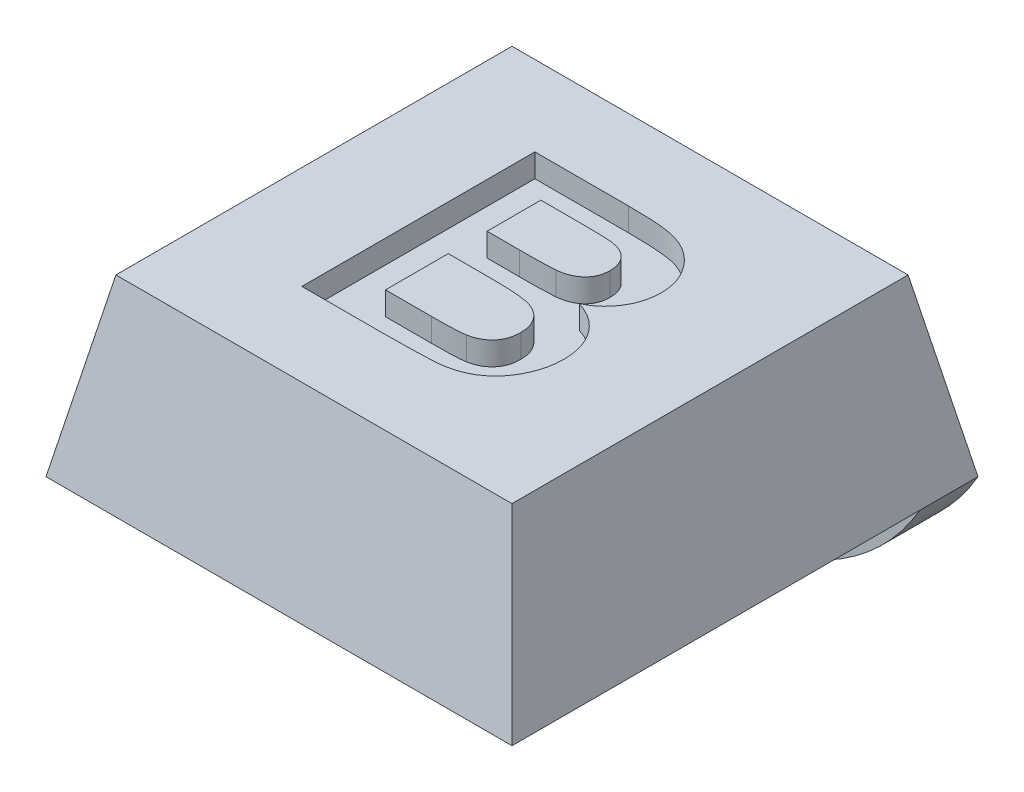
from build123d import *

# Parameters (mm, degrees)
SKETCH1_W               = 8
SKETCH1_H               = 8
BOSS_EXTRUDE1_DEPTH     = 3
CUT_EXTRUDE1_DEPTH      = 12.704699911
CUT_EXTRUDE1_DEPTH_BACK = 12.704699911
CUT_EXTRUDE2_DEPTH      = 11
SKETCH4_R               = 1.75
CUT_EXTRUDE3_DEPTH      = 0.4
SKETCH5_W               = 8
SKETCH5_H               = 1
BOSS_EXTRUDE2_DEPTH     = 2
FILLET1_R               = 4
CUT_EXTRUDE4_DEPTH      = 0.4


with BuildPart() as part:
    # Sketch1 → Boss-Extrude1 (new body)
    with BuildSketch(Plane(origin=(0, 0, 0), x_dir=(1, 0, 0), z_dir=(0, 1, 0))):
        with Locations((4, 4)):
            Rectangle(SKETCH1_W, SKETCH1_H)
    extrude(amount=BOSS_EXTRUDE1_DEPTH)

    # Sketch2 → Cut-Extrude1 (cut, two sides: drawn at the far end of the back side and taken through both)
    with BuildSketch(Plane.XY.offset(-CUT_EXTRUDE1_DEPTH_BACK)):
        Polygon((0, 0), (0.6, 3), (0, 3), align=None)
        Polygon((8, 0), (7.4, 3), (8, 3), align=None)
    extrude(amount=CUT_EXTRUDE1_DEPTH + CUT_EXTRUDE1_DEPTH_BACK, mode=Mode.SUBTRACT)

    # Sketch3 → Cut-Extrude2 (cut)
    with BuildSketch(Plane(origin=(0, 0, 0), x_dir=(0, 0, -1), z_dir=(1, 0, 0))):
        Polygon((0, 0), (0.6, 3), (0, 3), align=None)
        Polygon((8, 3), (7.4, 3), (8, 0), align=None)
    extrude(amount=CUT_EXTRUDE2_DEPTH, mode=Mode.SUBTRACT)

    # Sketch4 → Cut-Extrude3 (cut)
    with BuildSketch(Plane.XZ):
        with Locations(Location((4, -3.75, 0), (0, 0, 270))):
            Circle(SKETCH4_R)
    extrude(amount=-CUT_EXTRUDE3_DEPTH, mode=Mode.SUBTRACT)

    # Sketch5 → Boss-Extrude2 (add)
    with BuildSketch(Plane.XZ):
        with Locations((4, -7.5)):
            Rectangle(SKETCH5_W, SKETCH5_H)
    extrude(amount=BOSS_EXTRUDE2_DEPTH)

    # Fillet1
    # the kernel refuses this fillet: 4 mm, written as the material it takes off along each edge
    with BuildSketch(Plane(origin=(8, -2, -16.660254038), x_dir=(0, 1, 0), z_dir=(0, 0, 1)), Plane(origin=(0, -2, 1.660254038), x_dir=(0, 1, 0), z_dir=(0, 0, -1))) as fillet1_piece_1:
        with BuildLine():
            CenterArc((4, 3.464101615), FILLET1_R, 180, 60)
            Line((0, 3.464101615), (-0.08, 3.464101615))
            Line((-0.08, 3.464101615), (-0.08, 0))
            Line((-0.08, 0), (0, -0.08))
            ThreePointArc((0, -0.08), (1, -0.08), (1.96, -0.069282032))
            Line((1.96, -0.069282032), (2, 0))
        make_face()
    extrude(amount=18.320508076, mode=Mode.SUBTRACT)

    # Sketch6 → Cut-Extrude4 (cut)
    with BuildSketch(Plane(origin=(0, 3, 0), x_dir=(1, 0, 0), z_dir=(0, 1, 0))):
        with BuildLine():
            Line((2.366875023, 6.025988971), (3.978253228, 6.025988971))
            add(Edge.make_bspline(
                [(3.978253228, 6.025988971), (4.016981522, 6.025758539), (4.091770291, 6.025313549), (4.200234262, 6.02407341), (4.300910244, 6.020431423), (4.393955008, 6.01730407), (4.479059098, 6.009990491), (4.556891378, 6.004244483), (4.627206795, 5.996339471), (4.710040188, 5.983546816), (4.806360793, 5.963648743), (4.915152558, 5.926842691), (5.018276483, 5.880857129), (5.114182519, 5.822393524), (5.203189243, 5.754016663), (5.28597738, 5.676271174), (5.358728101, 5.58601543), (5.424238976, 5.487508268), (5.479534837, 5.380666952), (5.517612886, 5.26572697), (5.541913225, 5.144795761), (5.544858568, 5.061898711), (5.546362202, 5.019578715)],
                knots=[0, 0, 0, 0, 1.096610875, 2.117681168, 3.071055591, 3.949137991, 4.753059115, 5.489127199, 6.15892391, 6.75575099, 7.862330316, 8.938514814, 10.001276227, 11.05313779, 12.110449801, 13.174958802, 14.260456508, 15.384725817, 16.521138801, 17.654729897, 18.802709851, 20, 20, 20, 20], degree=3))
            add(Edge.make_bspline(
                [(5.546362202, 5.019578715), (5.544802721, 4.973493311), (5.541727769, 4.882623117), (5.513106772, 4.749371009), (5.467516851, 4.621879661), (5.40315043, 4.502217288), (5.324314646, 4.392405777), (5.231065087, 4.295977947), (5.12477188, 4.213520097), (5.044958184, 4.17248881), (5.004695536, 4.151790253)],
                knots=[0, 0, 0, 0, 1.023065178, 2.01725758, 3.014298905, 4.023406433, 5.026736079, 6.009055718, 6.99565244, 8, 8, 8, 8], degree=3))
            add(Edge.make_bspline(
                [(5.004695536, 4.151790253), (5.0318132, 4.142553707), (5.085431798, 4.12429068), (5.162178571, 4.090754541), (5.234086142, 4.051862796), (5.301118401, 4.008841827), (5.363784101, 3.961377137), (5.420252395, 3.907894911), (5.473763466, 3.851437899), (5.520742036, 3.789172127), (5.563264851, 3.724075672), (5.599360366, 3.65512964), (5.630616076, 3.583992364), (5.656755805, 3.509943884), (5.675388869, 3.432487562), (5.69031884, 3.352599145), (5.697956597, 3.269724954), (5.699451608, 3.213768347), (5.700208356, 3.185444099)],
                knots=[0, 0, 0, 0, 1.072651974, 2.1209089, 3.132484228, 4.131466326, 5.101889999, 6.071643115, 7.041396231, 8.011819904, 8.988565287, 9.95070344, 10.922775742, 11.897213062, 12.887138018, 13.903598663, 14.938838629, 16, 16, 16, 16], degree=3))
            add(Edge.make_bspline(
                [(5.700208356, 3.185444099), (5.698598844, 3.140212221), (5.695387249, 3.049957264), (5.671387404, 2.915316113), (5.630853991, 2.783046233), (5.575963383, 2.654005704), (5.507783193, 2.532330941), (5.427626978, 2.4212421), (5.334105775, 2.324584109), (5.230539132, 2.239414342), (5.113835126, 2.16890592), (4.984093466, 2.114745557), (4.842134035, 2.073828468), (4.742124288, 2.060236169), (4.690592972, 2.053232561)],
                knots=[0, 0, 0, 0, 0.975059807, 1.945618526, 2.93861228, 3.952760547, 4.963632603, 5.940527786, 6.897802811, 7.855787948, 8.824773195, 9.82606706, 10.879852914, 12, 12, 12, 12], degree=3))
            add(Edge.make_bspline(
                [(4.690592972, 2.053232561), (4.670833027, 2.051565703), (4.625472552, 2.047739302), (4.548543711, 2.042982046), (4.453955886, 2.039386091), (4.341791209, 2.035134329), (4.211704387, 2.032064432), (4.063991072, 2.029968108), (3.898399223, 2.027247493), (3.782207382, 2.026423), (3.72104169, 2.025988971)],
                knots=[0, 0, 0, 0, 0.490565993, 1.126131979, 1.906526787, 2.832178623, 3.902933831, 5.125497984, 6.486805064, 8, 8, 8, 8], degree=3))
            Line((3.72104169, 2.025988971), (2.366875023, 2.025988971))
            Line((2.366875023, 2.025988971), (2.366875023, 6.025988971))
        make_face()
        with BuildLine():
            Line((3.136105792, 5.359322304), (3.136105792, 4.436245381))
            Line((3.136105792, 4.436245381), (3.692996818, 4.436245381))
            add(Edge.make_bspline(
                [(3.692996818, 4.436245381), (3.732259986, 4.43615888), (3.807047978, 4.435994114), (3.91334909, 4.43709824), (4.008173732, 4.437613694), (4.091249283, 4.439126475), (4.162558686, 4.441623123), (4.221845003, 4.444116229), (4.269450826, 4.446003799), (4.297170592, 4.448699163), (4.309182715, 4.449867176)],
                knots=[0, 0, 0, 0, 1.528479216, 2.911428072, 4.138414629, 5.21998762, 6.145918986, 6.915989543, 7.530253335, 8, 8, 8, 8], degree=3))
            add(Edge.make_bspline(
                [(4.309182715, 4.449867176), (4.3438238, 4.455079871), (4.41040184, 4.465098351), (4.503567155, 4.494454854), (4.584375726, 4.536913614), (4.653724553, 4.58976356), (4.708773054, 4.654604252), (4.749170144, 4.72919452), (4.772805412, 4.813847791), (4.775653451, 4.873327339), (4.777131433, 4.904194099)],
                knots=[0, 0, 0, 0, 1.162079002, 2.233444551, 3.225172046, 4.179556897, 5.110707885, 6.027301426, 6.976273101, 8, 8, 8, 8], degree=3))
            add(Edge.make_bspline(
                [(4.777131433, 4.904194099), (4.776203651, 4.934000177), (4.774422539, 4.991220438), (4.752297006, 5.072236392), (4.719032932, 5.144995211), (4.670409719, 5.207709385), (4.609395094, 5.260672186), (4.534716376, 5.302043411), (4.446732173, 5.330510733), (4.38335661, 5.340467498), (4.3500481, 5.345700509)],
                knots=[0, 0, 0, 0, 1.044241546, 2.004684189, 2.928111627, 3.838334562, 4.769594837, 5.748424953, 6.81663206, 8, 8, 8, 8], degree=3))
            add(Edge.make_bspline(
                [(4.3500481, 5.345700509), (4.336967148, 5.34687206), (4.306041436, 5.349641817), (4.252292165, 5.35144236), (4.183926257, 5.353976507), (4.100595234, 5.356449705), (4.002296842, 5.357959731), (3.889310645, 5.358468661), (3.761641688, 5.359577608), (3.671629596, 5.359410545), (3.624086561, 5.359322304)],
                knots=[0, 0, 0, 0, 0.433943041, 1.02591908, 1.776648879, 2.694999143, 3.780816848, 5.02540149, 6.428861738, 8, 8, 8, 8], degree=3))
            Line((3.624086561, 5.359322304), (3.136105792, 5.359322304))
        make_face(mode=Mode.SUBTRACT)
        with BuildLine():
            Line((3.136105792, 3.769578715), (3.136105792, 2.692655638))
            Line((3.136105792, 2.692655638), (3.921362202, 2.692655638))
            add(Edge.make_bspline(
                [(3.921362202, 2.692655638), (3.957955896, 2.692474114), (4.027408125, 2.692129595), (4.126486109, 2.694437139), (4.214933064, 2.69519802), (4.293162962, 2.698994102), (4.360764719, 2.701865798), (4.418016495, 2.705445849), (4.464471269, 2.711139165), (4.491885355, 2.715559172), (4.503894254, 2.717495381)],
                knots=[0, 0, 0, 0, 1.504773752, 2.85595359, 4.075347731, 5.141676974, 6.076328919, 6.858106537, 7.499786952, 8, 8, 8, 8], degree=3))
            add(Edge.make_bspline(
                [(4.503894254, 2.717495381), (4.534390702, 2.723929926), (4.593642924, 2.736431746), (4.675765739, 2.772305806), (4.749780788, 2.817800627), (4.813883543, 2.876271003), (4.866572685, 2.946316906), (4.904617992, 3.02809262), (4.927561873, 3.120636015), (4.929805566, 3.185839411), (4.930977587, 3.219899227)],
                knots=[0, 0, 0, 0, 1.031056579, 2.003262591, 2.954260215, 3.900917722, 4.862741126, 5.841340256, 6.872396835, 8, 8, 8, 8], degree=3))
            add(Edge.make_bspline(
                [(4.930977587, 3.219899227), (4.930031736, 3.249108452), (4.928190747, 3.305960799), (4.910169932, 3.38739087), (4.88101832, 3.461844609), (4.840421058, 3.528813936), (4.789699747, 3.589139928), (4.726998003, 3.639624345), (4.654607383, 3.681685756), (4.585597801, 3.709395341), (4.520158829, 3.72717269), (4.457743787, 3.73883498), (4.382520906, 3.748066566), (4.294854864, 3.755875466), (4.194389919, 3.762120128), (4.081396073, 3.767043008), (3.95555801, 3.769103428), (3.867409493, 3.769415255), (3.821201946, 3.769578715)],
                knots=[0, 0, 0, 0, 0.992165387, 1.931134082, 2.820086661, 3.700270762, 4.583075858, 5.486803518, 6.423132184, 7.421722103, 8.005700193, 8.727213115, 9.57900282, 10.582332745, 11.720121093, 13.002085041, 14.428489784, 16, 16, 16, 16], degree=3))
            Line((3.821201946, 3.769578715), (3.136105792, 3.769578715))
        make_face(mode=Mode.SUBTRACT)
    extrude(amount=-CUT_EXTRUDE4_DEPTH, mode=Mode.SUBTRACT)


solid = part.part
